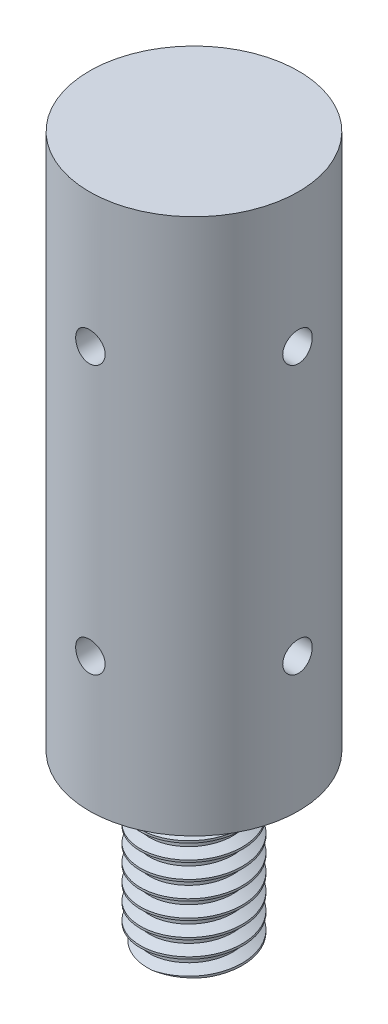
from build123d import *
from build123d.topology import SkipClean

# Parameters (mm, degrees)
SKETCH1_R           = 4.953
BOSS_EXTRUDE1_DEPTH = 25.4
SKETCH2_R           = 2.413
BOSS_EXTRUDE2_DEPTH = 7.62
THREAD2_PITCH       = 0.79375
SKETCH8_R           = 0.6985
CUT_EXTRUDE1_DEPTH  = 3.175
CIRPATTERN1_COUNT   = 4


with BuildPart() as part:
    # Sketch1 → Boss-Extrude1 (new body)
    with BuildSketch(Plane(origin=(0, 0, 0), x_dir=(1, 0, 0), z_dir=(0, 1, 0))):
        with Locations(Location((0, 0, 0), (0, 0, 270))):
            Circle(SKETCH1_R)
    extrude(amount=BOSS_EXTRUDE1_DEPTH)

    # Sketch2 → Boss-Extrude2 (add)
    with BuildSketch(Plane.XZ):
        with Locations(Location((0, 0, 0), (0, 0, 90))):
            Circle(SKETCH2_R)
    extrude(amount=BOSS_EXTRUDE2_DEPTH)

    # Thread2: the profile of Thread Profile2 profile screwed along a right-hand helix of 9.6 turns, 8 arcs to a turn; built about Z, then put on its axis
    with SkipClean():  # the faces are left unmerged after this step: merging them gives an invalid solid
        thread2_z = Axis((0, 0, 0), (0, 0, 1))
        thread2_corners = [(2.4133, 0, -0.000173205), (2.4133, 0, 0.694704453), (1.983370212, 0, 0.446484374), (1.983370212, 0, 0.248046874)]
        with BuildLine(mode=Mode.PRIVATE) as thread2_profile:
            Line(thread2_corners[0], thread2_corners[1])
            Line(thread2_corners[1], thread2_corners[2])
            Line(thread2_corners[2], thread2_corners[3])
            Line(thread2_corners[3], thread2_corners[0])
        thread2_cap = Face(thread2_profile.wire())
        thread2_turn_angles = [0, 22.5, 45, 67.5, 90, 112.5, 135, 157.5, 180, 202.5, 225, 247.5, 270, 292.5, 315, 337.5, 360]
        thread2_turn_weights = [1, 0.9238795325112867, 1, 0.9238795325112867, 1, 0.9238795325112867, 1, 0.9238795325112867, 1, 0.9238795325112867, 1, 0.9238795325112867, 1, 0.9238795325112867, 1, 0.9238795325112867, 1]
        thread2_turn_rails = [Edge.make_bspline([Vector(p[0], p[1], 0).rotate(thread2_z, thread2_turn_angles[k]) / thread2_turn_weights[k] + Vector(0, 0, p[2] + THREAD2_PITCH * thread2_turn_angles[k] / 360) for k in range(17)], [0, 0, 0, 1, 1, 2, 2, 3, 3, 4, 4, 5, 5, 6, 6, 7, 7, 8, 8, 8], 2, thread2_turn_weights) for p in thread2_corners]
        thread2_turn_sides = [Face.make_surface_from_curves(thread2_turn_rails[p[0]], thread2_turn_rails[p[1]]) for p in [(0, 1), (1, 2), (2, 3), (3, 0)]]
        thread2_last_angles = [3240, 3262.5, 3285, 3307.5, 3330, 3352.5, 3375, 3397.5, 3420, 3438, 3456]
        thread2_last_weights = [1, 0.9238795325112867, 1, 0.9238795325112867, 1, 0.9238795325112867, 1, 0.9238795325112867, 1, 0.9510565162951535, 1]
        thread2_last_rails = [Edge.make_bspline([Vector(p[0], p[1], 0).rotate(thread2_z, thread2_last_angles[k]) / thread2_last_weights[k] + Vector(0, 0, p[2] + THREAD2_PITCH * thread2_last_angles[k] / 360) for k in range(11)], [0, 0, 0, 1, 1, 2, 2, 3, 3, 4, 4, 5, 5, 5], 2, thread2_last_weights) for p in thread2_corners]
        thread2_last_sides = [Face.make_surface_from_curves(thread2_last_rails[p[0]], thread2_last_rails[p[1]]) for p in [(0, 1), (1, 2), (2, 3), (3, 0)]]
        thread2 = Plane(origin=(0, 0, 0), x_dir=(-1, 0, 0), z_dir=(0, -1, 0)) * Solid(Shell([*[p.moved(Location((0, 0, THREAD2_PITCH * i))) for i in range(9) for p in thread2_turn_sides], *thread2_last_sides, thread2_cap, thread2_cap.rotate(thread2_z, 3456).moved(Location((0, 0, THREAD2_PITCH * 3456 / 360)))]))
        add(thread2, mode=Mode.SUBTRACT)

    # Sketch8 → Cut-Extrude1 (cut)
    with SkipClean():  # the faces are left unmerged after this step: merging them gives an invalid solid
        with BuildSketch(Plane.ZY.offset(4.953)):
            with Locations((0, 6.35)):
                Circle(SKETCH8_R)
            with Locations((0, 19.05)):
                Circle(SKETCH8_R)
        cut_extrude1 = extrude(amount=-CUT_EXTRUDE1_DEPTH, mode=Mode.SUBTRACT)

    # CirPattern1: Cut-Extrude1 ×4 about axis
    with SkipClean():  # the faces are left unmerged after this step: merging them gives an invalid solid
        cirpattern1_axis = Axis((0, 0, 0), (0, 1, 0))
        for i in range(1, CIRPATTERN1_COUNT):
            add(cut_extrude1.rotate(cirpattern1_axis, i * 360 / CIRPATTERN1_COUNT), mode=Mode.SUBTRACT)


solid = part.part
